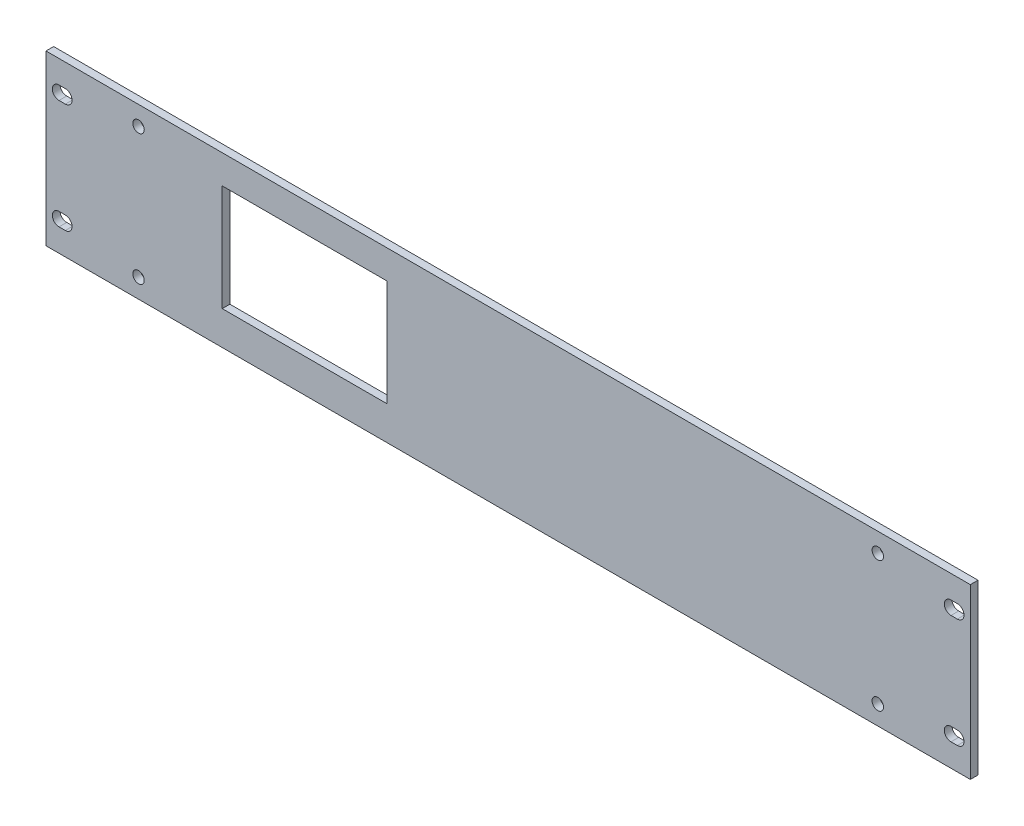
from build123d import *

# Parameters (mm, degrees)
SKETCH_1_W          = 482.6
SKETCH_1_H          = 88.1
EXTRUDE_1_DEPTH     = 4
CUT_EXTRUDE_1_DEPTH = 491.591856842
SKETCH_3_R          = 3
CUT_EXTRUDE_2_DEPTH = 491.591856842
SKETCH_4_W          = 86
SKETCH_4_H          = 55.5
CUT_EXTRUDE_3_DEPTH = 491.591856842


with BuildPart() as part:
    # Эскиз1 → Бобышка-Вытянуть1 (new body)
    with BuildSketch(Plane.XY):
        with Locations((241.3, 44.05)):
            Rectangle(SKETCH_1_W, SKETCH_1_H)
    extrude(amount=EXTRUDE_1_DEPTH)

    # Эскиз2 → Вырез-Вытянуть1 (cut, through all)
    with BuildSketch(Plane.XY.offset(4)):
        with BuildLine():
            Line((6.8, 76.12), (10.1, 76.12))
            ThreePointArc((10.1, 76.12), (13.6, 72.62), (10.1, 69.12))
            Line((10.1, 69.12), (6.8, 69.12))
            ThreePointArc((6.8, 69.12), (3.3, 72.62), (6.8, 76.12))
        make_face()
        with BuildLine():
            Line((472.5, 76.12), (475.8, 76.12))
            ThreePointArc((475.8, 76.12), (479.3, 72.62), (475.8, 69.12))
            Line((475.8, 69.12), (472.5, 69.12))
            ThreePointArc((472.5, 69.12), (469, 72.62), (472.5, 76.12))
        make_face()
        with BuildLine():
            Line((472.5, 18.97), (475.8, 18.97))
            ThreePointArc((475.8, 18.97), (479.3, 15.47), (475.8, 11.97))
            Line((475.8, 11.97), (472.5, 11.97))
            ThreePointArc((472.5, 11.97), (469, 15.47), (472.5, 18.97))
        make_face()
        with BuildLine():
            Line((6.8, 18.97), (10.1, 18.97))
            ThreePointArc((10.1, 18.97), (13.6, 15.47), (10.1, 11.97))
            Line((10.1, 11.97), (6.8, 11.97))
            ThreePointArc((6.8, 11.97), (3.3, 15.47), (6.8, 18.97))
        make_face()
    extrude(amount=-CUT_EXTRUDE_1_DEPTH, mode=Mode.SUBTRACT)

    # Эскиз3 → Вырез-Вытянуть2 (cut, through all)
    with BuildSketch(Plane.XY.offset(4)):
        with Locations((48.3, 78.1)):
            Circle(SKETCH_3_R)
        with Locations((434.3, 78.1)):
            Circle(SKETCH_3_R)
        with Locations((434.3, 10)):
            Circle(SKETCH_3_R)
        with Locations((48.3, 10)):
            Circle(SKETCH_3_R)
    extrude(amount=-CUT_EXTRUDE_2_DEPTH, mode=Mode.SUBTRACT)

    # Эскиз4 → Вырез-Вытянуть3 (cut, through all)
    with BuildSketch(Plane.XY.offset(4)):
        with Locations((135, 45.35)):
            Rectangle(SKETCH_4_W, SKETCH_4_H)
    extrude(amount=-CUT_EXTRUDE_3_DEPTH, mode=Mode.SUBTRACT)


solid = part.part
